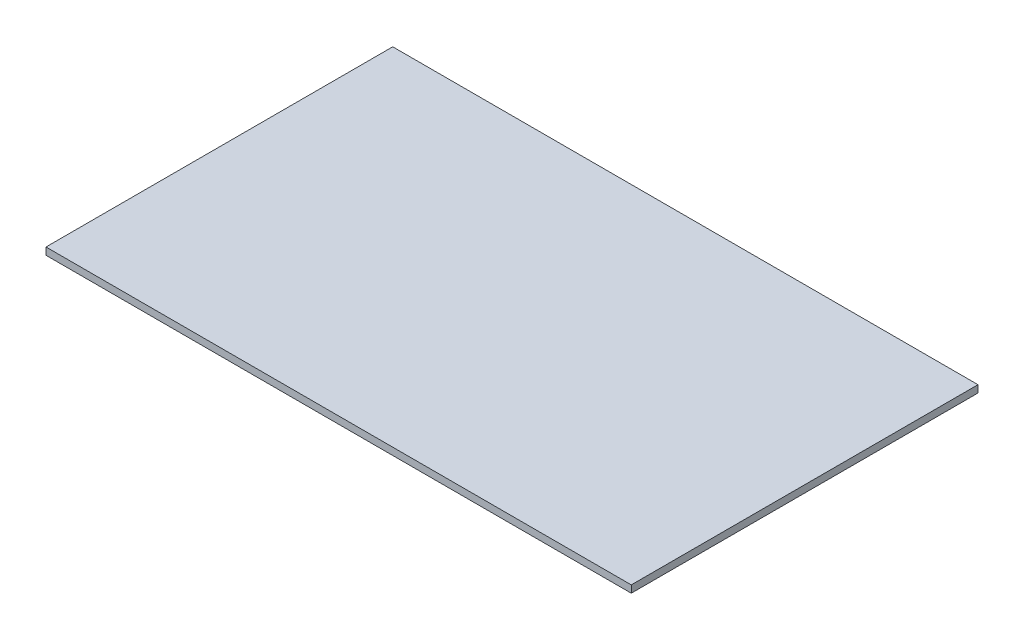
from build123d import *

# Parameters (mm, degrees)
SKETCH1_W           = 514.477487426
SKETCH1_H           = 304.8
BOSS_EXTRUDE1_DEPTH = 6.35


with BuildPart() as part:
    # Sketch1 → Boss-Extrude1 (new body)
    with BuildSketch(Plane(origin=(0, 0, 0), x_dir=(1, 0, 0), z_dir=(0, 1, 0))):
        with Locations((257.238743713, 152.4)):
            Rectangle(SKETCH1_W, SKETCH1_H)
    extrude(amount=BOSS_EXTRUDE1_DEPTH)


solid = part.part
